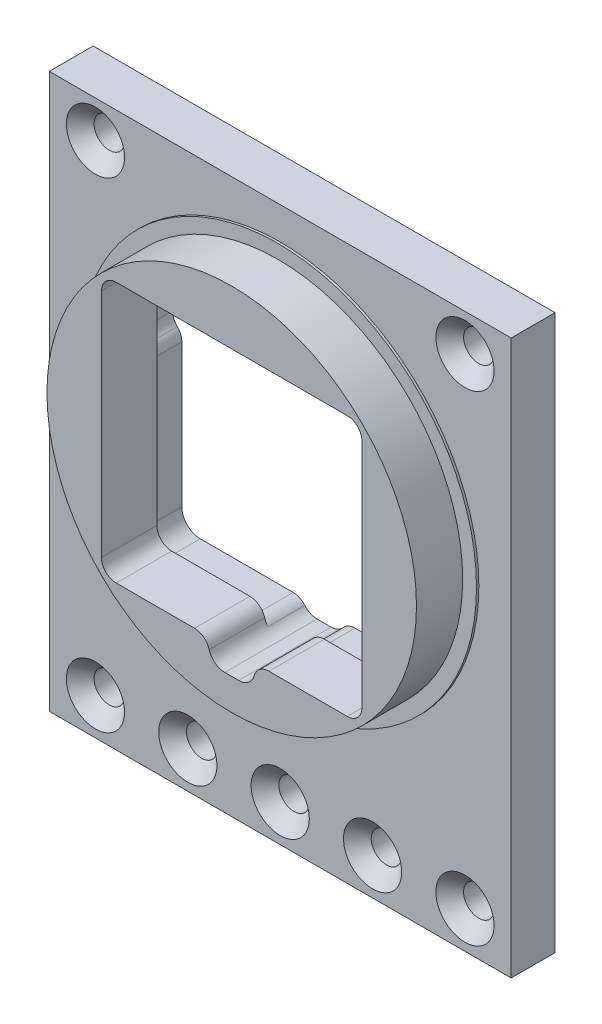
from build123d import *

# Parameters (mm, degrees)
ESQUISSE1_W                                    = 100
ESQUISSE1_H                                    = 100
ESQUISSE1_W_2                                  = 56.4
ESQUISSE1_H_2                                  = 56.4
BOSS_EXTRU_1_DEPTH                             = 10
CONG_1_R                                       = 3.2
BOSS_EXTRU_2_START                             = 10
ESQUISSE3_R                                    = 40
BOSS_EXTRU_2_DEPTH                             = 10
ESQUISSE4_OUTSIDE_W                            = 130.566
ESQUISSE4_OUTSIDE_H                            = 130.566
ESQUISSE4_OUTSIDE_R                            = 43
ENL_V_MAT_EXTRU_2_DEPTH                        = 0.5
ESQUISSE5_W                                    = 61.6
ESQUISSE5_H                                    = 61.6
ENL_V_MAT_EXTRU_3_DEPTH                        = 9
ESQUISSE6_W                                    = 61.6
ESQUISSE6_H                                    = 61.6
BOSS_EXTRU_3_DEPTH                             = 1
ESQUISSE12_W                                   = 100
ESQUISSE12_H                                   = 9.5
BOSS_EXTRU_5_DEPTH                             = 20
FRAISAGE_POUR_VIS_T_TE_FRAIS_E_M61_D           = 6.6
FRAISAGE_POUR_VIS_T_TE_FRAIS_E_M61_CSINK_D     = 12.6
FRAISAGE_POUR_VIS_T_TE_FRAIS_E_M61_CSINK_ANGLE = 90
ESQUISSE16_W                                   = 2
ESQUISSE16_H                                   = 10
ENL_V_MAT_EXTRU_4_DEPTH                        = 8
CONG_3_R                                       = 3.5
ESQUISSE17_W                                   = 10
ESQUISSE17_H                                   = 5
ENL_V_MAT_EXTRU_5_DEPTH                        = 89.317608663
CONG_4_R                                       = 3.5
CONG_5_R                                       = 3.3
CONG_6_R                                       = 4


with BuildPart() as part:
    # Esquisse1 → Boss.-Extru.1 (new body)
    with BuildSketch(Plane.XY):
        Rectangle(ESQUISSE1_W, ESQUISSE1_H)
        Rectangle(ESQUISSE1_W_2, ESQUISSE1_H_2, mode=Mode.SUBTRACT)
    extrude(amount=BOSS_EXTRU_1_DEPTH)

    # Congé1
    cong_1_edges = [part.edges().sort_by_distance(p)[0] for p in [
        (-28.2, 28.2, 5),
        (-28.2, -28.2, 5),
        (28.2, -28.2, 5),
        (28.2, 28.2, 5),
    ]]
    fillet(cong_1_edges, radius=CONG_1_R)

    # Esquisse3 → Boss.-Extru.2 (add)
    with BuildSketch(Plane.XY.offset(10).offset(BOSS_EXTRU_2_START)):
        Circle(ESQUISSE3_R)
        with BuildLine():
            Line((-28.2, 25), (-28.2, -25))
            ThreePointArc((-28.2, -25), (-27.2627417, -27.2627417), (-25, -28.2))
            Line((-25, -28.2), (25, -28.2))
            ThreePointArc((25, -28.2), (27.2627417, -27.2627417), (28.2, -25))
            Line((28.2, -25), (28.2, 25))
            ThreePointArc((28.2, 25), (27.2627417, 27.2627417), (25, 28.2))
            Line((25, 28.2), (-25, 28.2))
            ThreePointArc((-25, 28.2), (-27.2627417, 27.2627417), (-28.2, 25))
        make_face(mode=Mode.SUBTRACT)
    extrude(amount=-BOSS_EXTRU_2_DEPTH)

    # Esquisse4 outside → Enlèv. mat.-Extru.2 (cut)
    with BuildSketch(Plane.XY.offset(10)):
        Rectangle(ESQUISSE4_OUTSIDE_W, ESQUISSE4_OUTSIDE_H)
        Circle(ESQUISSE4_OUTSIDE_R, mode=Mode.SUBTRACT)
    extrude(amount=-ENL_V_MAT_EXTRU_2_DEPTH, mode=Mode.SUBTRACT)

    # Esquisse5 → Enlèv. mat.-Extru.3 (cut)
    with BuildSketch(Plane(origin=(0, 0, 0), x_dir=(-1, 0, 0), z_dir=(0, 0, -1))):
        Rectangle(ESQUISSE5_W, ESQUISSE5_H)
    extrude(amount=-ENL_V_MAT_EXTRU_3_DEPTH, mode=Mode.SUBTRACT)

    # Esquisse6 → Boss.-Extru.3 (add)
    with BuildSketch(Plane(origin=(0, 0, 9), x_dir=(-1, 0, 0), z_dir=(0, 0, -1))):
        Rectangle(ESQUISSE6_W, ESQUISSE6_H)
        with BuildLine():
            Line((28.2, -25), (28.2, 25))
            ThreePointArc((28.2, 25), (27.2627417, 27.2627417), (25, 28.2))
            Line((25, 28.2), (-25, 28.2))
            ThreePointArc((-25, 28.2), (-27.2627417, 27.2627417), (-28.2, 25))
            Line((-28.2, 25), (-28.2, -25))
            ThreePointArc((-28.2, -25), (-27.2627417, -27.2627417), (-25, -28.2))
            Line((-25, -28.2), (25, -28.2))
            ThreePointArc((25, -28.2), (27.2627417, -27.2627417), (28.2, -25))
        make_face(mode=Mode.SUBTRACT)
    extrude(amount=BOSS_EXTRU_3_DEPTH)

    # Esquisse12 → Boss.-Extru.5 (add)
    with BuildSketch(Plane.XZ.offset(50)):
        with Locations((0, 4.75)):
            Rectangle(ESQUISSE12_W, ESQUISSE12_H)
    extrude(amount=BOSS_EXTRU_5_DEPTH)

    # Fraisage pour vis à tête fraisée M61 (through all)
    with Locations(Plane(origin=(-40, -62, 9.5), x_dir=(1, 0, 0), z_dir=(0, 0, 1))):
        with Locations((0, 0), (20, 0), (40, 0), (60, 0), (80, 0), (0, 104), (80, 104)):
            CounterSinkHole(FRAISAGE_POUR_VIS_T_TE_FRAIS_E_M61_D / 2, FRAISAGE_POUR_VIS_T_TE_FRAIS_E_M61_CSINK_D / 2, counter_sink_angle=FRAISAGE_POUR_VIS_T_TE_FRAIS_E_M61_CSINK_ANGLE)

    # Esquisse16 → Enlèv. mat.-Extru.4 (cut)
    with BuildSketch(Plane(origin=(0, 0, 0), x_dir=(-1, 0, 0), z_dir=(0, 0, -1))):
        with Locations((31.8, 10.8)):
            Rectangle(ESQUISSE16_W, ESQUISSE16_H)
        with Locations((-31.8, -10.8)):
            Rectangle(ESQUISSE16_W, ESQUISSE16_H)
    extrude(amount=-ENL_V_MAT_EXTRU_4_DEPTH, mode=Mode.SUBTRACT)

    # Congé3
    # the kernel refuses this fillet: 3.5 mm, written as the material it adds along each edge
    with BuildSketch(Plane(origin=(32.8, -5.8, 0), x_dir=(-1, 0, 0), z_dir=(0, 0, 1)), Plane(origin=(-32.8, 5.8, 0), x_dir=(1, 0, 0), z_dir=(0, 0, 1))) as cong_3_piece_1:
        with BuildLine():
            CenterArc((3.5, 3.16227766), CONG_3_R, 180, 64.623066475)
            Line((0, 3.16227766), (-0.07, 3.16227766))
            Line((-0.07, 3.16227766), (-0.07, 0))
            Line((-0.07, 0), (0, -0.07))
            ThreePointArc((0, -0.07), (1, -0.07), (1.97, -0.063245553))
            Line((1.97, -0.063245553), (2, 0))
        make_face()
    extrude(amount=15.90569415)
    with BuildSketch(Plane(origin=(32.8, -15.8, 0), x_dir=(-1, 0, 0), z_dir=(0, 0, 1)), Plane(origin=(-32.8, 15.8, 0), x_dir=(1, 0, 0), z_dir=(0, 0, 1))) as cong_3_piece_2:
        with BuildLine():
            CenterArc((3.5, -3.16227766), CONG_3_R, 115.376933525, 64.623066475)
            Line((0, -3.16227766), (-0.07, -3.16227766))
            Line((-0.07, -3.16227766), (-0.07, 0))
            Line((-0.07, 0), (0, 0.07))
            ThreePointArc((0, 0.07), (1, 0.07), (1.97, 0.063245553))
            Line((1.97, 0.063245553), (2, 0))
        make_face()
    extrude(amount=15.90569415)

    # Esquisse17 → Enlèv. mat.-Extru.5 (cut, through all)
    with BuildSketch(Plane.XY.offset(20)):
        with Locations((0, -30.7)):
            Rectangle(ESQUISSE17_W, ESQUISSE17_H)
    extrude(amount=-ENL_V_MAT_EXTRU_5_DEPTH, mode=Mode.SUBTRACT)

    # Congé4
    cong_4_edges = [part.edges().sort_by_distance(p)[0] for p in [
        (5, -33.2, 10),
        (-5, -33.2, 10),
    ]]
    fillet(cong_4_edges, radius=CONG_4_R)

    # Congé5
    # the kernel refuses this fillet: 3.3 mm, written as the material it takes off along each edge
    with BuildSketch(Plane(origin=(-30.8, 5.8, -4.135900428), x_dir=(0, -1, 0), z_dir=(0, 0, 1))) as cong_5_piece_1:
        with BuildLine():
            CenterArc((1.654360171, -3.3), CONG_5_R, 90, 45.099127844)
            ThreePointArc((-0.683125835, -0.970588235), (-0.300120774, -0.514462201), (0, 0))
            Line((0, 0), (1.654360171, 0))
        make_face()
    extrude(amount=12.135900428, mode=Mode.SUBTRACT)
    with BuildSketch(Plane(origin=(-30.8, 15.8, -4.135900428), x_dir=(0, 1, 0), z_dir=(0, 0, 1)), Plane(origin=(30.8, -15.8, -4.135900428), x_dir=(0, -1, 0), z_dir=(0, 0, 1))) as cong_5_piece_2:
        with BuildLine():
            CenterArc((1.654360171, 3.3), CONG_5_R, 224.900872156, 45.099127844)
            ThreePointArc((-0.683125835, 0.970588235), (-0.300120774, 0.514462201), (0, 0))
            Line((0, 0), (1.654360171, 0))
        make_face()
    extrude(amount=12.135900428, mode=Mode.SUBTRACT)
    with BuildSketch(Plane(origin=(30.8, -5.8, -4.135900428), x_dir=(0.8177591102711759, -0.5755606289249594, 0), z_dir=(0, 0, 1))) as cong_5_piece_3:
        with BuildLine():
            CenterArc((1.746420483, 3.252218177), CONG_5_R, 215.138902841, 45.099127844)
            Line((-0.952184581, 1.352868102), (0, 0))
            ThreePointArc((0, 0), (0.593443854, 0.050677691), (1.186887707, 0))
        make_face()
    extrude(amount=12.135900428, mode=Mode.SUBTRACT)
    with BuildSketch(Plane(origin=(5, -28.2, 27.643596311), x_dir=(-0.0513844627897584, -0.9986789458999363, 0), z_dir=(0, 0, -1))) as cong_5_piece_4:
        with BuildLine():
            CenterArc((3.138535685, -3.22296821), CONG_5_R, 102.404067037, 74.650522983)
            Line((-0.157104836, -3.053399483), (-0.486668888, -3.03644261))
            Line((-0.486668888, -3.03644261), (-0.329564052, 0.016956873))
            Line((-0.329564052, 0.016956873), (0.016956873, 0.329564052))
            ThreePointArc((0.016956873, 0.329564052), (1.514975292, 0.252487358), (2.358794792, 0.322296821))
            Line((2.358794792, 0.322296821), (2.429680327, 0))
        make_face()
    extrude(amount=27.287192622, mode=Mode.SUBTRACT)
    with BuildSketch(Plane(origin=(-5, -28.2, 27.643596311), x_dir=(0.05138446278975914, -0.9986789458999363, 0), z_dir=(0, 0, -1))) as cong_5_piece_5:
        with BuildLine():
            CenterArc((3.138535685, 3.22296821), CONG_5_R, 182.94540998, 74.650522983)
            Line((-0.157104836, 3.053399483), (-0.486668888, 3.03644261))
            Line((-0.486668888, 3.03644261), (-0.329564052, -0.016956873))
            Line((-0.329564052, -0.016956873), (0.016956873, -0.329564052))
            ThreePointArc((0.016956873, -0.329564052), (1.514975292, -0.252487358), (2.358794792, -0.322296821))
            Line((2.358794792, -0.322296821), (2.429680327, 0))
        make_face()
    extrude(amount=27.287192622, mode=Mode.SUBTRACT)
    with BuildSketch(Plane(origin=(4.822649545, -30.8, 8), x_dir=(1, 0, 0), z_dir=(0, 0, -1))) as cong_5_piece_6:
        with BuildLine():
            CenterArc((1.861943014, 3.3), CONG_5_R, 220.32021507, 49.67978493)
            ThreePointArc((-0.654109258, 1.164705882), (-0.270973964, 0.613848345), (0, 0))
            Line((0, 0), (1.861943014, 0))
        make_face()
    extrude(amount=12.654857534, mode=Mode.SUBTRACT)
    with BuildSketch(Plane(origin=(-4.822649545, -30.8, -4.654857534), x_dir=(0.4896709556510413, -0.8719073088303573, 0), z_dir=(0, 0, 1))) as cong_5_piece_7:
        with BuildLine():
            CenterArc((1.965554704, -3.239355876), CONG_5_R, 101.001258329, 49.67978493)
            Line((-0.911739415, -1.623441722), (0, 0))
            ThreePointArc((0, 0), (0.667906938, -0.064319526), (1.335813877, 0))
        make_face()
    extrude(amount=12.654857534, mode=Mode.SUBTRACT)

    # Congé6
    cong_6_edges = [part.edges().sort_by_distance(p)[0] for p in [
        (-30.8, -30.8, 4),
        (30.8, -30.8, 4),
        (-30.8, 30.8, 4),
        (30.8, 30.8, 4),
    ]]
    fillet(cong_6_edges, radius=CONG_6_R)


solid = part.part
